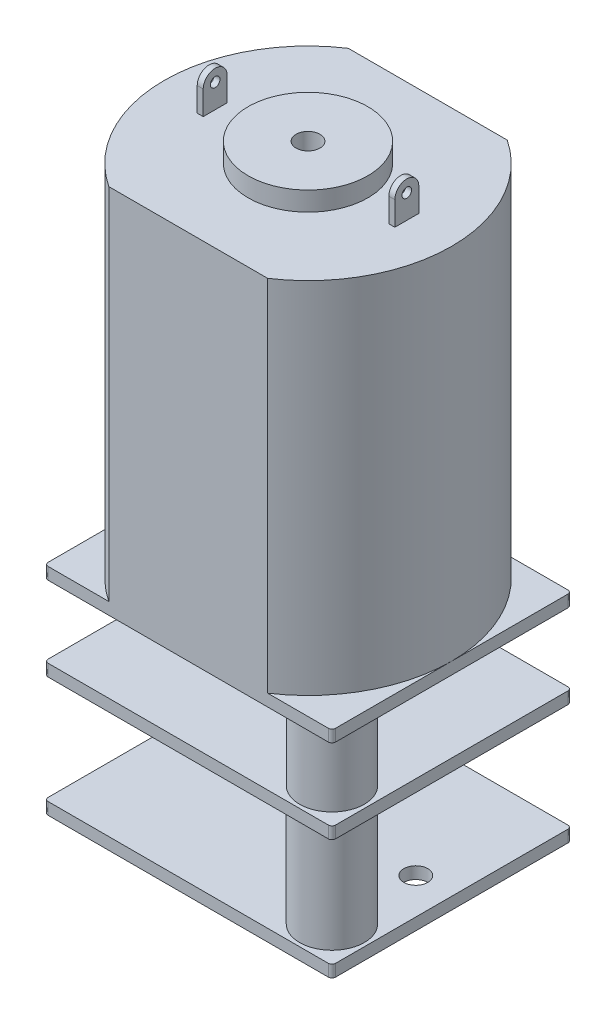
from build123d import *

# Parameters (mm, degrees)
SKETCH1_R            = 2.5
SKETCH1_W            = 0.25
SKETCH1_H            = 1
SKETCH1_R_2          = 0.5
BOSS_EXTRUDE1_DEPTH  = 15
SKETCH1_3_R          = 2.5
SKETCH1_3_R_2        = 0.5
BOSS_EXTRUDE2_DEPTH  = 0.8
SKETCH1_5_W          = 0.25
SKETCH1_5_H          = 1
BOSS_EXTRUDE3_DEPTH  = 1.5
SKETCH2_R            = 0.200548898
CUT_EXTRUDE3_DEPTH   = 1.5
BOSS_EXTRUDE4_DEPTH  = 0.5
BOSS_EXTRUDE6_START  = 3
BOSS_EXTRUDE6_DEPTH  = 0.5
SKETCH6_R            = 1.35
BOSS_EXTRUDE7_DEPTH  = 8
BOSS_EXTRUDE9_START  = 4.5
SKETCH9_R            = 0.5
SKETCH9_R_2          = 1.5
BOSS_EXTRUDE9_DEPTH  = 0.5
SKETCH10_R           = 2
SKETCH10_R_2         = 1.5
BOSS_EXTRUDE10_DEPTH = 0.5
FILLET1_R            = 0.5
BOSS_EXTRUDE11_START = -0.5
SKETCH11_R           = 1.5
BOSS_EXTRUDE11_DEPTH = 0.5


with BuildPart() as part:
    # Sketch1 → Boss-Extrude1 (new body)
    # profile 1 of 5: a face of its own
    with BuildSketch(Plane(origin=(0, 0, 0), x_dir=(1, 0, 0), z_dir=(0, 1, 0))):
        with BuildLine():
            Line((-3.31662479, -5), (3.31662479, -5))
            ThreePointArc((3.31662479, -5), (6, 0), (3.31662479, 5))
            Line((3.31662479, 5), (-3.31662479, 5))
            ThreePointArc((-3.31662479, 5), (-6, 0), (-3.31662479, -5))
        make_face()
        Circle(SKETCH1_R, mode=Mode.SUBTRACT)
        with Locations((4, 0)):
            Rectangle(SKETCH1_W, SKETCH1_H, mode=Mode.SUBTRACT)
        with Locations((-4, 0)):
            Rectangle(SKETCH1_W, SKETCH1_H, mode=Mode.SUBTRACT)
    # profile 2 of 5: a face of its own
    with BuildSketch(Plane(origin=(0, 0, 0), x_dir=(1, 0, 0), z_dir=(0, 1, 0))):
        Circle(SKETCH1_R)
        Circle(SKETCH1_R_2, mode=Mode.SUBTRACT)
    # profile 3 of 5: a face of its own
    with BuildSketch(Plane(origin=(0, 0, 0), x_dir=(1, 0, 0), z_dir=(0, 1, 0))):
        with Locations((-4, 0)):
            Rectangle(SKETCH1_W, SKETCH1_H)
    # profile 4 of 5: a face of its own
    with BuildSketch(Plane(origin=(0, 0, 0), x_dir=(1, 0, 0), z_dir=(0, 1, 0))):
        Circle(SKETCH1_R_2)
    # profile 5 of 5: a face of its own
    with BuildSketch(Plane(origin=(0, 0, 0), x_dir=(1, 0, 0), z_dir=(0, 1, 0))):
        with Locations((4, 0)):
            Rectangle(SKETCH1_W, SKETCH1_H)
    extrude(amount=-BOSS_EXTRUDE1_DEPTH)

    # Sketch1<3> → Boss-Extrude2 (add)
    with BuildSketch(Plane(origin=(0, 0, 0), x_dir=(1, 0, 0), z_dir=(0, 1, 0))):
        with Locations(Location((0, 0, 0), (0, 0, 270))):
            Circle(SKETCH1_3_R)
        with Locations(Location((0, 0, 0), (0, 0, 270))):
            Circle(SKETCH1_3_R_2, mode=Mode.SUBTRACT)
    extrude(amount=BOSS_EXTRUDE2_DEPTH)

    # Sketch1<5> → Boss-Extrude3 (add)
    with BuildSketch(Plane(origin=(0, 0, 0), x_dir=(1, 0, 0), z_dir=(0, 1, 0))):
        with Locations((-4, 0)):
            Rectangle(SKETCH1_5_W, SKETCH1_5_H)
    boss_extrude3 = extrude(amount=BOSS_EXTRUDE3_DEPTH)

    # Sketch2 → Cut-Extrude3 (cut)
    with BuildSketch(Plane.ZY.offset(4.125)):
        with Locations((0, 1)):
            Circle(SKETCH2_R)
        with BuildLine():
            Line((-0.5, 1.5), (-0.5, 1))
            ThreePointArc((-0.5, 1), (-0.353553391, 1.353553391), (0, 1.5))
            Line((0, 1.5), (-0.5, 1.5))
        make_face()
        with BuildLine():
            Line((0.5, 1.5), (0, 1.5))
            ThreePointArc((0, 1.5), (0.353553391, 1.353553391), (0.5, 1))
            Line((0.5, 1), (0.5, 1.5))
        make_face()
    cut_extrude3 = extrude(amount=-CUT_EXTRUDE3_DEPTH, mode=Mode.SUBTRACT)

    # Mirror1: Boss-Extrude3, Cut-Extrude3 across plane
    add(boss_extrude3.mirror(Plane(origin=(0, 0, 0), x_dir=(0, 0, 1), z_dir=(1, 0, 0))))
    add(cut_extrude3.mirror(Plane(origin=(0, 0, 0), x_dir=(0, 0, 1), z_dir=(1, 0, 0))), mode=Mode.SUBTRACT)

    # Sketch3 → Boss-Extrude4 (add)
    with BuildSketch(Plane.XZ.offset(15)):
        with BuildLine():
            Line((-5.84848114, -5), (5.84848114, -5))
            ThreePointArc((5.84848114, -5), (5.955621153, -4.955621153), (6, -4.84848114))
            Line((6, -4.84848114), (6, 4.84848114))
            ThreePointArc((6, 4.84848114), (5.955621153, 4.955621153), (5.84848114, 5))
            Line((5.84848114, 5), (-5.84848114, 5))
            ThreePointArc((-5.84848114, 5), (-5.955621153, 4.955621153), (-6, 4.84848114))
            Line((-6, 4.84848114), (-6, -4.84848114))
            ThreePointArc((-6, -4.84848114), (-5.955621153, -4.955621153), (-5.84848114, -5))
        make_face()
    extrude(amount=BOSS_EXTRUDE4_DEPTH)



with BuildPart() as body_2:
    # Sketch7 → Boss-Extrude6 (new body)
    with BuildSketch(Plane.XZ.offset(15.5).offset(BOSS_EXTRUDE6_START)):
        with BuildLine():
            Line((-6, -4.84848114), (-6, 4.84848114))
            ThreePointArc((-6, 4.84848114), (-5.955621153, 4.955621153), (-5.84848114, 5))
            Line((-5.84848114, 5), (5.84848114, 5))
            ThreePointArc((5.84848114, 5), (5.955621153, 4.955621153), (6, 4.84848114))
            Line((6, 4.84848114), (6, -4.84848114))
            ThreePointArc((6, -4.84848114), (5.955621153, -4.955621153), (5.84848114, -5))
            Line((5.84848114, -5), (-5.84848114, -5))
            ThreePointArc((-5.84848114, -5), (-5.955621153, -4.955621153), (-6, -4.84848114))
        make_face()
    extrude(amount=BOSS_EXTRUDE6_DEPTH)


with BuildPart() as part_1:
    add(part.part)

    add(body_2.part)  # Boss-Extrude7 merges body 2
    # Sketch6 → Boss-Extrude7 (add)
    with BuildSketch(Plane.XZ.offset(15.5)):
        with Locations(Location((-4.5, -3.5, 0), (0, 0, 90))):
            Circle(SKETCH6_R)
        with Locations(Location((4.5, 3.5, 0), (0, 0, 90))):
            Circle(SKETCH6_R)
    extrude(amount=BOSS_EXTRUDE7_DEPTH)

    # Sketch9 → Boss-Extrude9 (add)
    with BuildSketch(Plane.XZ.offset(19).offset(BOSS_EXTRUDE9_START)):
        with BuildLine():
            Line((-5.84848114, 5), (5.84848114, 5))
            ThreePointArc((5.84848114, 5), (5.955621153, 4.955621153), (6, 4.84848114))
            Line((6, 4.84848114), (6, -4.84848114))
            ThreePointArc((6, -4.84848114), (5.955621153, -4.955621153), (5.84848114, -5))
            Line((5.84848114, -5), (-5.84848114, -5))
            ThreePointArc((-5.84848114, -5), (-5.955621153, -4.955621153), (-6, -4.84848114))
            Line((-6, -4.84848114), (-6, 4.84848114))
            ThreePointArc((-6, 4.84848114), (-5.955621153, 4.955621153), (-5.84848114, 5))
        make_face()
        with Locations(Location((-4.5, 0, 0), (0, 0, 270))):
            Circle(SKETCH9_R, mode=Mode.SUBTRACT)
        with Locations(Location((4.5, 0, 0), (0, 0, 90))):
            Circle(SKETCH9_R, mode=Mode.SUBTRACT)
        with Locations(Location((0, 0, 0), (0, 0, 270))):
            Circle(SKETCH9_R_2, mode=Mode.SUBTRACT)
    extrude(amount=BOSS_EXTRUDE9_DEPTH)

    # Sketch10 → Boss-Extrude10 (add)
    with BuildSketch(Plane.XZ.offset(24)):
        with Locations(Location((0, 0, 0), (0, 0, 270))):
            Circle(SKETCH10_R)
        with Locations(Location((0, 0, 0), (0, 0, 270))):
            Circle(SKETCH10_R_2, mode=Mode.SUBTRACT)
    extrude(amount=BOSS_EXTRUDE10_DEPTH)

    # Fillet1
    fillet1_edges = [part_1.edges().sort_by_distance(p)[0] for p in [
        (0, -24.5, 2),
    ]]
    fillet(fillet1_edges, radius=FILLET1_R - 0.0001)  # a hair under: the kernel refuses the full size

    # Sketch11 → Boss-Extrude11 (add)
    with BuildSketch(Plane.XZ.offset(24).offset(BOSS_EXTRUDE11_START)):
        with Locations(Location((0, 0, 0), (0, 0, 270))):
            Circle(SKETCH11_R)
    extrude(amount=BOSS_EXTRUDE11_DEPTH)


solid = part_1.part
